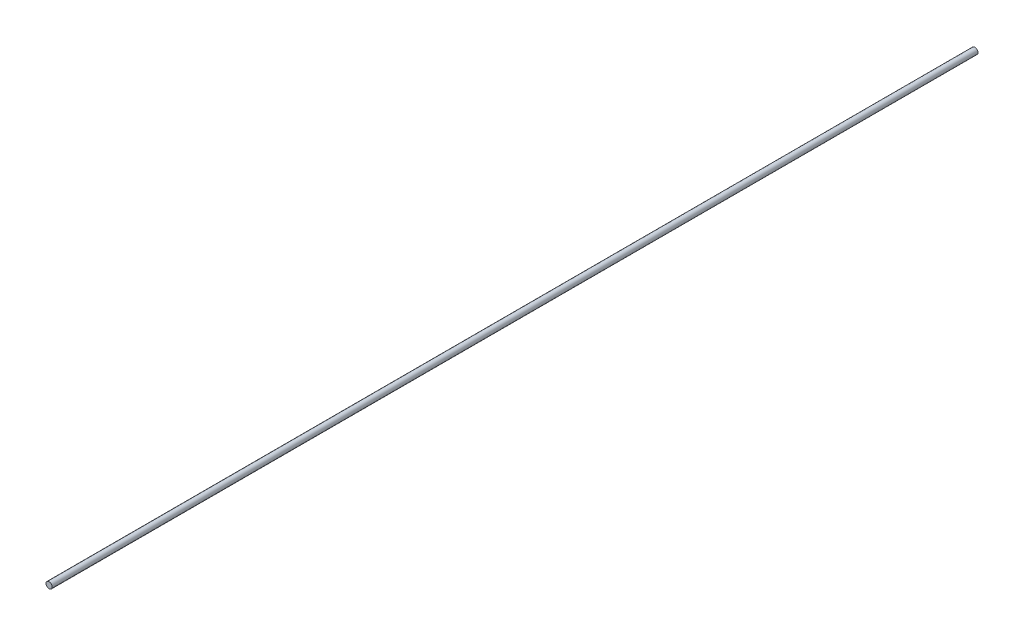
from build123d import *

# Parameters (mm, degrees)
SKETCH_1_R      = 0.5
EXTRUDE_1_DEPTH = 150


with BuildPart() as part:
    # Эскиз1 → Бобышка-Вытянуть1 (new body)
    with BuildSketch(Plane.XY):
        Circle(SKETCH_1_R)
    extrude(amount=EXTRUDE_1_DEPTH)


solid = part.part
